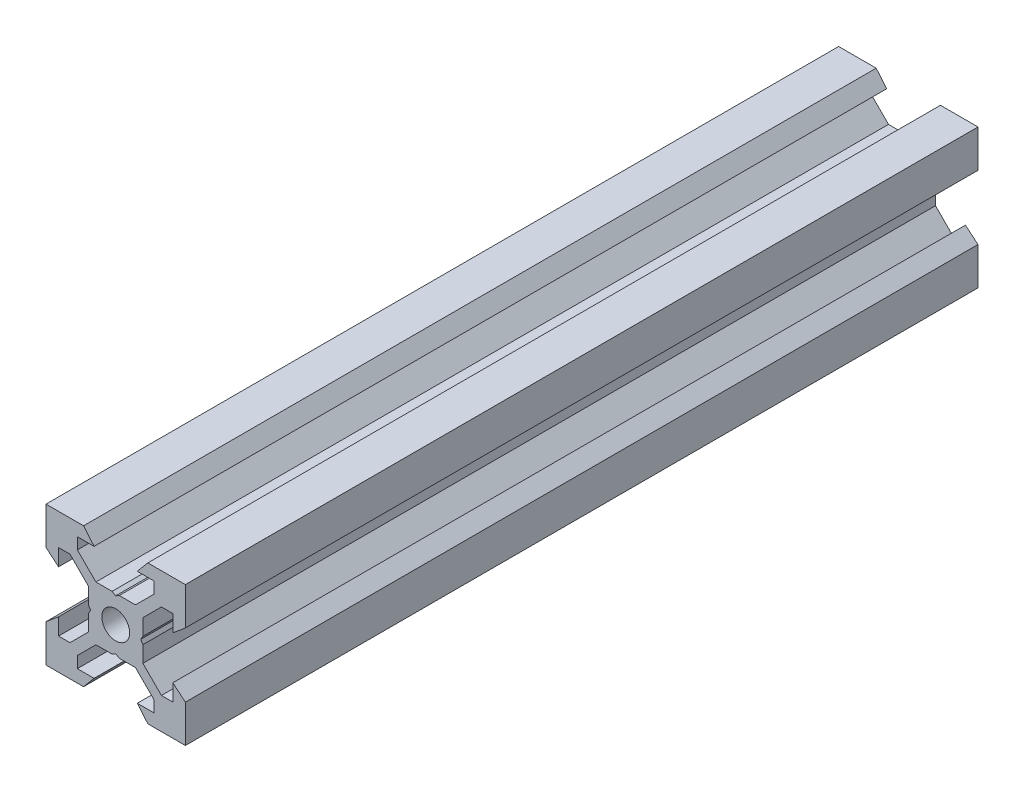
from build123d import *

# Parameters (mm, degrees)
SKETCH1_R           = 2
BOSS_EXTRUDE1_DEPTH = 56.87


with BuildPart() as part:
    # Sketch1 → Boss-Extrude1 (new, symmetric)
    with BuildSketch(Plane.XY):
        Polygon((10, 4.610379336), (10, 10), (4.610379336, 10), (3.1, 8.2), (5.5, 8.2), (5.5, 6.560660172), (2.839339828, 3.9), (0.519615242, 3.9), (0, 3.6), (-0.519615242, 3.9), (-2.839339828, 3.9), (-5.5, 6.560660172), (-5.5, 8.2), (-3.1, 8.2), (-4.610379336, 10), (-10, 10), (-10, 4.610379336), (-8.2, 3.1), (-8.2, 5.5), (-6.560660172, 5.5), (-3.9, 2.839339828), (-3.9, 0.519615242), (-3.6, 0), (-3.9, -0.519615242), (-3.9, -2.839339828), (-6.560660172, -5.5), (-8.2, -5.5), (-8.2, -3.1), (-10, -4.610379336), (-10, -10), (-4.610379336, -10), (-3.1, -8.2), (-5.5, -8.2), (-5.5, -6.560660172), (-2.839339828, -3.9), (-0.519615242, -3.9), (0, -3.6), (0.519615242, -3.9), (2.839339828, -3.9), (5.5, -6.560660172), (5.5, -8.2), (3.1, -8.2), (4.610379336, -10), (10, -10), (10, -4.610379336), (8.2, -3.1), (8.2, -5.5), (6.560660172, -5.5), (3.9, -2.839339828), (3.9, -0.519615242), (3.6, 0), (3.9, 0.519615242), (3.9, 2.839339828), (6.560660172, 5.5), (8.2, 5.5), (8.2, 3.1), align=None)
        Circle(SKETCH1_R, mode=Mode.SUBTRACT)
    extrude(amount=BOSS_EXTRUDE1_DEPTH, both=True)


solid = part.part
